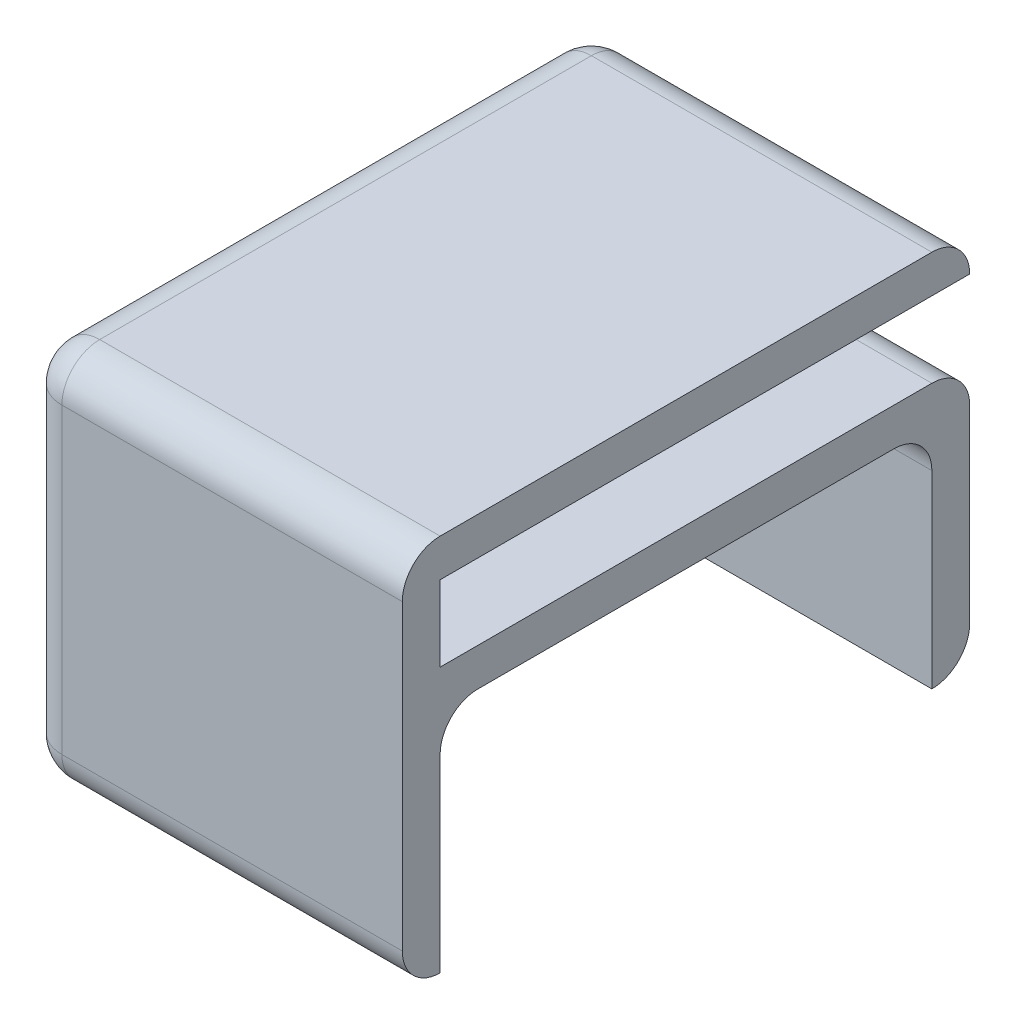
from build123d import *

# Parameters (mm, degrees)
SKETCH1_W           = 10
SKETCH1_H           = 15
BOSS_EXTRUDE1_DEPTH = 10
SHELL1_T            = -1
BOSS_EXTRUDE4_REACH = 21.9
SKETCH5_W           = 9
SKETCH5_H           = 1
SKETCH3_R           = 0.5
BOSS_EXTRUDE3_DEPTH = 0.5
BOSS_EXTRUDE5_START = 0.5
SKETCH6_R           = 0.5
BOSS_EXTRUDE5_DEPTH = 0.5
SKETCH8_W           = 9
SKETCH8_H           = 13
CUT_EXTRUDE1_DEPTH  = 21.14944168
SKETCH10_W          = 1
SKETCH10_H          = 2
CUT_EXTRUDE4_DEPTH  = 9
FILLET1_R           = 1
FILLET2_R           = 1
FILLET3_R           = 1
FILLET5_R           = 1


with BuildPart() as part:
    # Sketch1 → Boss-Extrude1 (new body)
    with BuildSketch(Plane(origin=(0, 0, 0), x_dir=(1, 0, 0), z_dir=(0, 1, 0))):
        with Locations((5, 7.5)):
            Rectangle(SKETCH1_W, SKETCH1_H)
    extrude(amount=BOSS_EXTRUDE1_DEPTH)

    # Shell1
    shell1_openings = [part.faces().sort_by_distance(p)[0] for p in [
        (10, 5, -7.5),
    ]]
    offset(amount=SHELL1_T, openings=shell1_openings, kind=Kind.INTERSECTION)

    # Sketch5 → Boss-Extrude4 (add, up to next)
    with BuildSketch(Plane.XY.offset(-14), mode=Mode.PRIVATE) as boss_extrude4_sk1:
        with Locations((5.5, 6.5)):
            Rectangle(SKETCH5_W, SKETCH5_H)
    boss_extrude4_tool1 = extrude(boss_extrude4_sk1.sketch, amount=BOSS_EXTRUDE4_REACH, mode=Mode.PRIVATE) - part.part
    add(boss_extrude4_tool1.solids().sort_by_distance((5.5, 6.5, -14))[0])

    # Sketch3 → Boss-Extrude3 (add)
    with BuildSketch(Plane(origin=(0, 9, 0), x_dir=(-1, 0, 0), z_dir=(0, -1, 0))):
        with Locations(Location((-7.5, 2.5, 0), (0, 0, 90))):
            Circle(SKETCH3_R)
    extrude(amount=BOSS_EXTRUDE3_DEPTH)

    # Sketch6 → Boss-Extrude5 (add)
    with BuildSketch(Plane(origin=(0, 7, 0), x_dir=(1, 0, 0), z_dir=(0, 1, 0)).offset(BOSS_EXTRUDE5_START)):
        with Locations(Location((7.5, 2.5, 0), (0, 0, 90))):
            Circle(SKETCH6_R)
    extrude(amount=-BOSS_EXTRUDE5_DEPTH)

    # Sketch8 → Cut-Extrude1 (cut, through all)
    with BuildSketch(Plane(origin=(0, 1, 0), x_dir=(1, 0, 0), z_dir=(0, 1, 0))):
        with Locations((5.5, 7.5)):
            Rectangle(SKETCH8_W, SKETCH8_H)
    extrude(amount=-CUT_EXTRUDE1_DEPTH, mode=Mode.SUBTRACT)

    # Sketch10 → Cut-Extrude4 (cut)
    with BuildSketch(Plane(origin=(10, 0, 0), x_dir=(0, 0, -1), z_dir=(1, 0, 0))):
        with Locations((14.5, 8)):
            Rectangle(SKETCH10_W, SKETCH10_H)
    extrude(amount=-CUT_EXTRUDE4_DEPTH, mode=Mode.SUBTRACT)

    # Fillet1
    fillet1_edges = [part.edges().sort_by_distance(p)[0] for p in [
        (0, 10, -7.5),
        (0, 0, -7.5),
    ]]
    fillet(fillet1_edges, radius=FILLET1_R - 0.0001)  # a hair under: the kernel refuses the full size

    # Fillet2
    fillet2_edges = [part.edges().sort_by_distance(p)[0] for p in [
        (5.49995, 0, 0),
        (0.292863929, 0.292863929, 0),
        (0, 5, 0),
        (0.292863929, 9.707136071, 0),
        (5.49995, 10, 0),
    ]]
    fillet(fillet2_edges, radius=FILLET2_R - 0.0001)  # a hair under: the kernel refuses the full size

    # Fillet3
    fillet3_edges = [part.edges().sort_by_distance(p)[0] for p in [
        (5.49995, 0, -15),
        (0.292863929, 0.292863929, -15),
        (0, 5, -15),
        (0.292863929, 9.707136071, -15),
        (5.49995, 10, -15),
    ]]
    fillet(fillet3_edges, radius=FILLET3_R - 0.0001)  # a hair under: the kernel refuses the full size

    # Fillet5
    fillet5_edges = [part.edges().sort_by_distance(p)[0] for p in [
        (5.5, 6, -1),
        (5.5, 6, -14),
        (5.5, 7, -15),
    ]]
    fillet(fillet5_edges, radius=FILLET5_R)


solid = part.part
